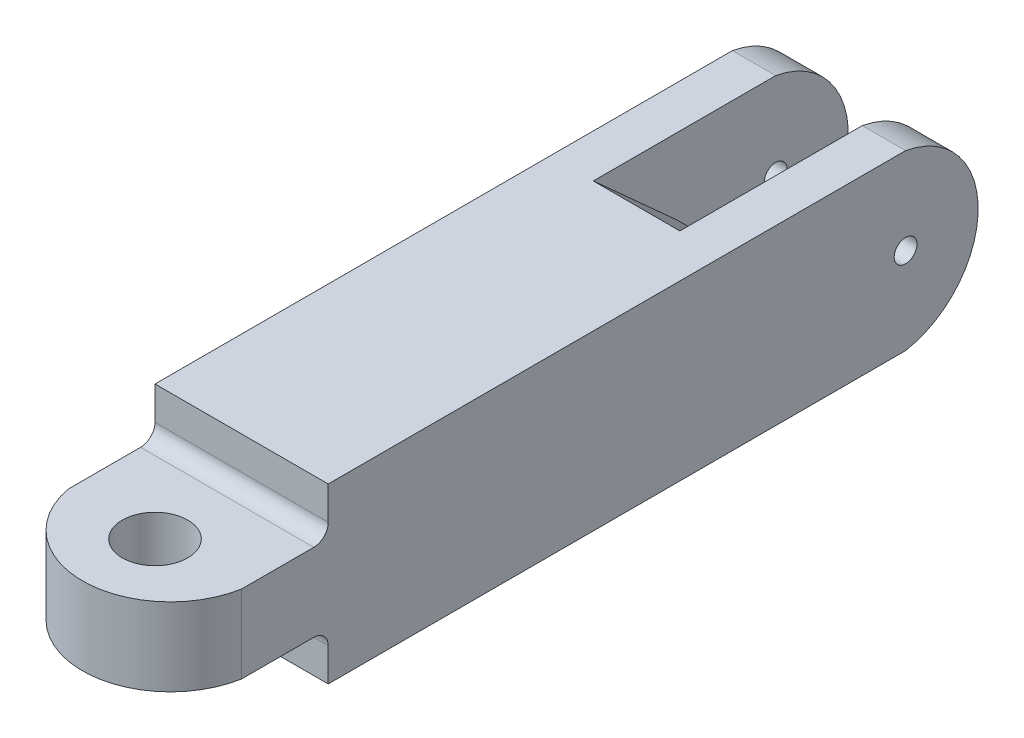
from build123d import *

# Parameters (mm, degrees)
SKETCH2_W               = 60
SKETCH2_H               = 60
BOSS_EXTRUDE1_DEPTH     = 170
SKETCH3_W               = 15
SKETCH3_H               = 60
BOSS_EXTRUDE2_DEPTH     = 30
BOSS_EXTRUDE3_DEPTH     = 15
BOSS_EXTRUDE4_START     = -15
BOSS_EXTRUDE4_DEPTH     = 15
SKETCH6_W               = 60
SKETCH6_H               = 27
BOSS_EXTRUDE5_DEPTH     = 30
BOSS_EXTRUDE6_DEPTH     = 27
CUT_EXTRUDE2_DEPTH      = 5
CUT_EXTRUDE2_DEPTH_BACK = 130
CUT_EXTRUDE2_START      = -10
SKETCH8_W               = 50.5
SKETCH8_H               = 50.5
SKETCH9_R               = 11.35
CUT_EXTRUDE3_DEPTH      = 130
SKETCH11_R              = 3.95
CUT_EXTRUDE4_DEPTH      = 232.543759953
SKETCH12_R              = 3.95
CUT_EXTRUDE5_DEPTH      = 232.543759953
CUT_EXTRUDE7_DEPTH      = 30
FILLET2_R               = 5
FILLET3_R               = 5


with BuildPart() as part:
    # Sketch2 → Boss-Extrude1 (new body)
    with BuildSketch(Plane.XY):
        Rectangle(SKETCH2_W, SKETCH2_H)
    extrude(amount=BOSS_EXTRUDE1_DEPTH)

    # Sketch3 → Boss-Extrude2 (add)
    with BuildSketch(Plane(origin=(0, 0, 0), x_dir=(-1, 0, 0), z_dir=(0, 0, -1))):
        with Locations((22.5, 0)):
            Rectangle(SKETCH3_W, SKETCH3_H)
        with Locations((-22.5, 0)):
            Rectangle(SKETCH3_W, SKETCH3_H)
    extrude(amount=BOSS_EXTRUDE2_DEPTH)

    # Sketch4 → Boss-Extrude3 (add)
    with BuildSketch(Plane(origin=(30, 0, 0), x_dir=(0, 0, -1), z_dir=(1, 0, 0))):
        with BuildLine():
            Line((30, 30), (30, -30))
            ThreePointArc((30, -30), (55.138874415, 0), (30, 30))
        make_face()
    extrude(amount=-BOSS_EXTRUDE3_DEPTH)

    # Sketch5 → Boss-Extrude4 (add)
    with BuildSketch(Plane.ZY.offset(30).offset(BOSS_EXTRUDE4_START)):
        with BuildLine():
            Line((-30, -30), (-30, 30))
            ThreePointArc((-30, 30), (-55.138874415, 0), (-30, -30))
        make_face()
    extrude(amount=BOSS_EXTRUDE4_DEPTH)

    # Sketch6 → Boss-Extrude5 (add)
    with BuildSketch(Plane.XY.offset(170)):
        Rectangle(SKETCH6_W, SKETCH6_H)
    extrude(amount=BOSS_EXTRUDE5_DEPTH)

    # Sketch7 → Boss-Extrude6 (add)
    with BuildSketch(Plane(origin=(0, 13.5, 0), x_dir=(1, 0, 0), z_dir=(0, 1, 0))):
        with BuildLine():
            Line((30, -200), (-30, -200))
            ThreePointArc((-30, -200), (0, -225.138874415), (30, -200))
        make_face()
    extrude(amount=-BOSS_EXTRUDE6_DEPTH)

    # Sketch8 → Cut-Extrude2 (cut, two sides: drawn at the far end of the back side and taken through both)
    with BuildSketch(Plane.XY.offset(170).offset(CUT_EXTRUDE2_START - CUT_EXTRUDE2_DEPTH_BACK)):
        Rectangle(SKETCH8_W, SKETCH8_H)
    extrude(amount=CUT_EXTRUDE2_DEPTH + CUT_EXTRUDE2_DEPTH_BACK, mode=Mode.SUBTRACT)

    # Sketch9 → Cut-Extrude3 (cut)
    with BuildSketch(Plane(origin=(0, -13.5, 0), x_dir=(-1, 0, 0), z_dir=(0, -1, 0))):
        with Locations((0, -200)):
            Circle(SKETCH9_R)
    extrude(amount=-CUT_EXTRUDE3_DEPTH, mode=Mode.SUBTRACT)

    # Sketch11 → Cut-Extrude4 (cut, through all)
    with BuildSketch(Plane.ZY.offset(-15)):
        with Locations((-30, 0)):
            Circle(SKETCH11_R)
    extrude(amount=-CUT_EXTRUDE4_DEPTH, mode=Mode.SUBTRACT)

    # Sketch12 → Cut-Extrude5 (cut, through all)
    with BuildSketch(Plane(origin=(-15, 0, 0), x_dir=(0, 0, -1), z_dir=(1, 0, 0))):
        with Locations((30, 0)):
            Circle(SKETCH12_R)
    extrude(amount=-CUT_EXTRUDE5_DEPTH, mode=Mode.SUBTRACT)

    # Sketch14 → Cut-Extrude7 (cut)
    with BuildSketch(Plane(origin=(-15, 0, 0), x_dir=(0, 0, -1), z_dir=(1, 0, 0))):
        Polygon((-33.188384016, 30), (0, 0), (0, 30), align=None)
        Polygon((0, -30), (0, 0), (-33.188384016, -30), align=None)
    extrude(amount=CUT_EXTRUDE7_DEPTH, mode=Mode.SUBTRACT)

    # Fillet2
    fillet2_edges = [part.edges().sort_by_distance(p)[0] for p in [
        (0, 0, 0),
    ]]
    fillet(fillet2_edges, radius=FILLET2_R)

    # Fillet3
    fillet3_edges = [part.edges().sort_by_distance(p)[0] for p in [
        (0, -13.5, 170),
        (0, 13.5, 170),
    ]]
    fillet(fillet3_edges, radius=FILLET3_R)


solid = part.part
